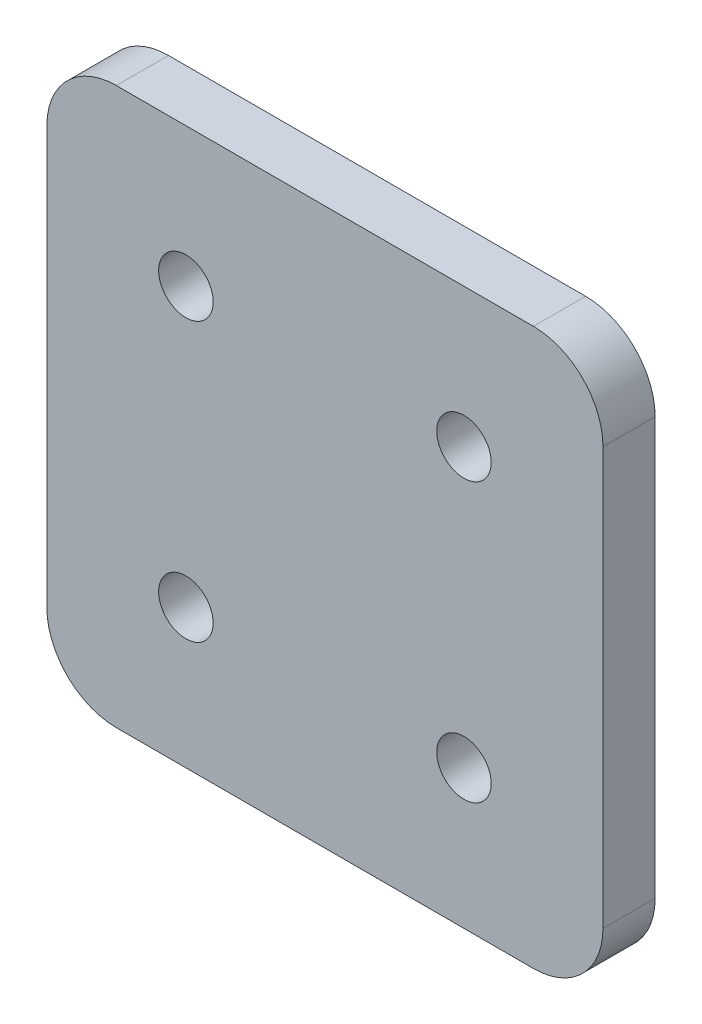
from build123d import *

# Parameters (mm, degrees)
SKETCH2_W           = 50.8
SKETCH2_H           = 50.8
BOSS_EXTRUDE1_DEPTH = 4.7625
SKETCH3_R           = 2.4892
CUT_EXTRUDE1_DEPTH  = 72.999731987
FILLET1_R           = 6.35


with BuildPart() as part:
    # Sketch2 → Boss-Extrude1 (new body)
    with BuildSketch(Plane.XY):
        with Locations((25.4, 25.4)):
            Rectangle(SKETCH2_W, SKETCH2_H)
    extrude(amount=-BOSS_EXTRUDE1_DEPTH)

    # Sketch3 → Cut-Extrude1 (cut, through all)
    with BuildSketch(Plane.XY):
        with Locations((12.7, 38.1)):
            Circle(SKETCH3_R)
        with Locations((38.1, 38.1)):
            Circle(SKETCH3_R)
        with Locations((12.7, 12.7)):
            Circle(SKETCH3_R)
        with Locations((12.7, -12.7)):
            Circle(SKETCH3_R)
        with Locations((38.1, 12.7)):
            Circle(SKETCH3_R)
        with Locations((38.1, -12.7)):
            Circle(SKETCH3_R)
    extrude(amount=-CUT_EXTRUDE1_DEPTH, mode=Mode.SUBTRACT)

    # Fillet1
    fillet1_edges = [part.edges().sort_by_distance(p)[0] for p in [
        (0, 0, -2.38125),
        (50.8, 0, -2.38125),
        (50.8, 50.8, -2.38125),
        (0, 50.8, -2.38125),
    ]]
    fillet(fillet1_edges, radius=FILLET1_R)


solid = part.part
